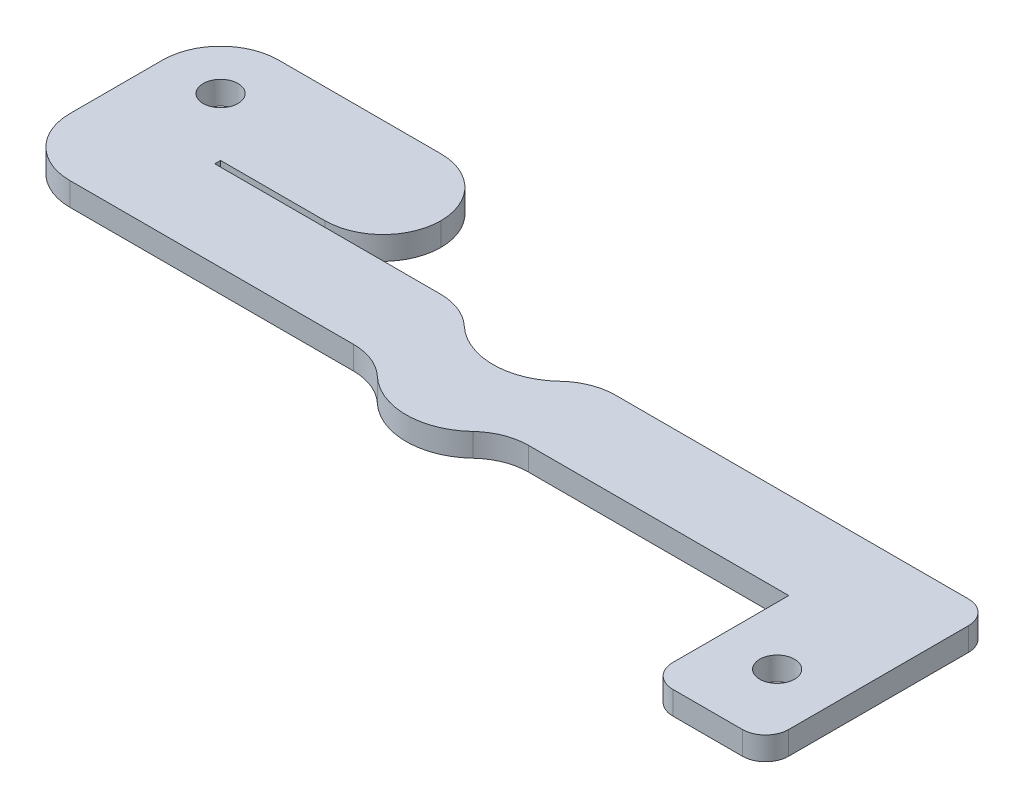
from build123d import *

# Parameters (mm, degrees)
SKETCH_1_R          = 1.5
EXTRUDE_1_DEPTH     = 2
FILLET_2_R          = 5
FILLET_3_R          = 5
SKETCH_7_R          = 6
CUT_EXTRUDE_4_DEPTH = 10
FILLET_5_R          = 5
SKETCH_8_W          = 10
SKETCH_8_H          = 2
EXTRUDE_3_DEPTH     = 12
SKETCH_9_R          = 1.5
CUT_EXTRUDE_5_DEPTH = 12
FILLET_6_R          = 2
SKETCH_10_W         = 10
SKETCH_10_H         = 2
EXTRUDE_4_DEPTH     = 14
FILLET_7_R          = 5
FILLET_8_R          = 5


with BuildPart() as part:
    # 草图1 → 凸台-拉伸1 (new body)
    with BuildSketch(Plane(origin=(0, 0, 0), x_dir=(1, 0, 0), z_dir=(0, 1, 0))):
        with BuildLine():
            Line((17.196152423, -13), (52, -13))
            Line((52, -13), (52, -5.5))
            Line((52, -5.5), (-15, -5.5))
            Line((-15, -5.5), (-15, 5))
            Line((-15, 5), (-25, 5))
            Line((-25, 5), (-25, -13))
            Line((-25, -13), (6.803847577, -13))
            ThreePointArc((6.803847577, -13), (12, -16), (17.196152423, -13))
        make_face()
        with Locations(Location((-20, 0, 0), (0, 0, 270))):
            Circle(SKETCH_1_R, mode=Mode.SUBTRACT)
    extrude(amount=EXTRUDE_1_DEPTH)

    # 圆角2
    fillet_2_edges = [part.edges().sort_by_distance(p)[0] for p in [
        (-25, 1, -5),
    ]]
    fillet(fillet_2_edges, radius=FILLET_2_R)

    # 圆角3
    fillet_3_edges = [part.edges().sort_by_distance(p)[0] for p in [
        (-25, 1, 13),
    ]]
    fillet(fillet_3_edges, radius=FILLET_3_R)

    # 草图7 → 切除-拉伸4 (cut)
    with BuildSketch(Plane(origin=(0, 2, 0), x_dir=(1, 0, 0), z_dir=(0, 1, 0))):
        with Locations((12, -2.5)):
            Circle(SKETCH_7_R)
    extrude(amount=-CUT_EXTRUDE_4_DEPTH, mode=Mode.SUBTRACT)

    # 圆角5
    fillet_5_edges = [part.edges().sort_by_distance(p)[0] for p in [
        (17.196152423, 1, 13),
        (6.803847577, 1, 13),
        (6.803847577, 1, 5.5),
        (17.196152423, 1, 5.5),
    ]]
    fillet(fillet_5_edges, radius=FILLET_5_R)

    # 草图8 → 凸台-拉伸3 (add)
    with BuildSketch(Plane.XY.offset(13)):
        with Locations((47, 1)):
            Rectangle(SKETCH_8_W, SKETCH_8_H)
    extrude(amount=EXTRUDE_3_DEPTH)

    # 草图9 → 切除-拉伸5 (cut)
    with BuildSketch(Plane(origin=(0, 2, 0), x_dir=(1, 0, 0), z_dir=(0, 1, 0))):
        with Locations(Location((47, -19, 0), (0, 0, 270))):
            Circle(SKETCH_9_R)
    extrude(amount=-CUT_EXTRUDE_5_DEPTH, mode=Mode.SUBTRACT)

    # 圆角6
    fillet_6_edges = [part.edges().sort_by_distance(p)[0] for p in [
        (52, 1, 5.5),
        (52, 1, 25),
        (42, 1, 25),
    ]]
    fillet(fillet_6_edges, radius=FILLET_6_R)

    # 草图10 → 凸台-拉伸4 (add)
    with BuildSketch(Plane(origin=(-15, 0, 0), x_dir=(0, 0, -1), z_dir=(1, 0, 0))):
        with Locations((0, 1)):
            Rectangle(SKETCH_10_W, SKETCH_10_H)
    extrude(amount=EXTRUDE_4_DEPTH)

    # 圆角7
    fillet_7_edges = [part.edges().sort_by_distance(p)[0] for p in [
        (-1, 1, 5),
    ]]
    fillet(fillet_7_edges, radius=FILLET_7_R)

    # 圆角8
    fillet_8_edges = [part.edges().sort_by_distance(p)[0] for p in [
        (-1, 1, -5),
    ]]
    fillet(fillet_8_edges, radius=FILLET_8_R - 0.0001)  # a hair under: the kernel refuses the full size


solid = part.part
